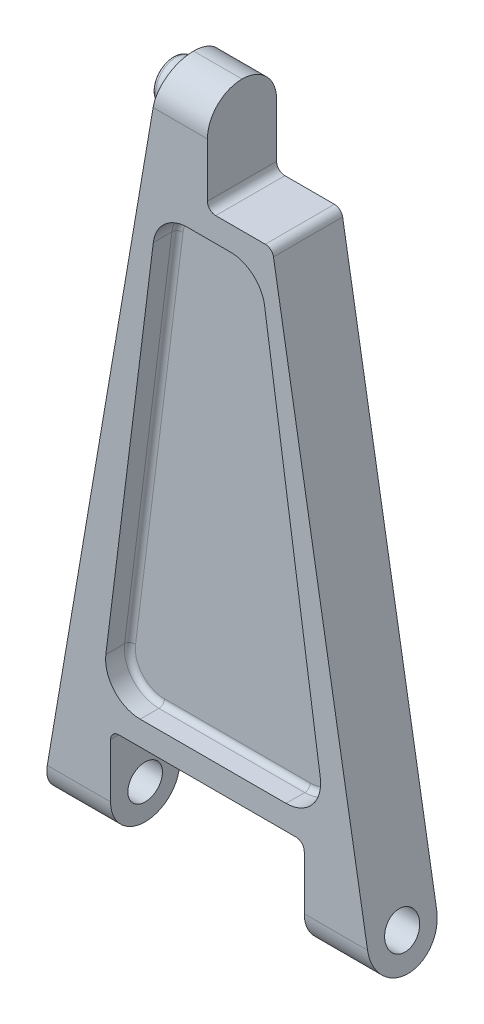
from build123d import *

# Parameters (mm, degrees)
BOSS_EXTRUDE1_DEPTH     = 50
FILLET1_R               = 50
CUT_EXTRUDE2_DEPTH      = 1030.611577246
CUT_EXTRUDE2_DEPTH_BACK = 1030.611577246
SKETCH4_W               = 280
SKETCH4_H               = 140
SKETCH4_W_2             = 94
SKETCH5_R               = 30
BOSS_EXTRUDE2_DEPTH     = 100
FILLET2_R               = 5
FILLET3_R               = 12
CUT_EXTRUDE4_DEPTH      = 35
FILLET4_R               = 50
FILLET5_R               = 8
FILLET4_OF_MIRROR1_R    = 50
FILLET5_OF_MIRROR1_R    = 8
SKETCH7_R               = 25
CUT_EXTRUDE5_DEPTH      = 250


with BuildPart() as part:
    # Sketch1 → Boss-Extrude1 (new, symmetric)
    with BuildSketch(Plane.XY):
        Polygon((-240, 0), (240, 0), (70, 1000), (-70, 1000), align=None)
    extrude(amount=BOSS_EXTRUDE1_DEPTH, both=True)

    # Fillet1
    fillet1_edges = [part.edges().sort_by_distance(p)[0] for p in [
        (0, 1000, 50),
        (0, 1000, -50),
        (0, 0, 50),
        (0, 0, -50),
    ]]
    fillet(fillet1_edges, radius=FILLET1_R - 0.0001)  # a hair under: the kernel refuses the full size

    # Sketch4 → Cut-Extrude2 (cut, two sides: drawn at the far end of the back side and taken through both)
    with BuildSketch(Plane.XY.offset(-CUT_EXTRUDE2_DEPTH_BACK)):
        with Locations((0, 70)):
            Rectangle(SKETCH4_W, SKETCH4_H)
        with Locations((47, 930)):
            Rectangle(SKETCH4_W_2, SKETCH4_H)
    extrude(amount=CUT_EXTRUDE2_DEPTH + CUT_EXTRUDE2_DEPTH_BACK, mode=Mode.SUBTRACT)

    # Sketch5 → Boss-Extrude2 (add)
    with BuildSketch(Plane(origin=(0, 0, 0), x_dir=(0, 0, -1), z_dir=(1, 0, 0))):
        with Locations((0, 950)):
            Circle(SKETCH5_R)
    extrude(amount=-BOSS_EXTRUDE2_DEPTH)

    # Fillet2
    fillet2_edges = [part.edges().sort_by_distance(p)[0] for p in [
        (-100, 950, 30),
    ]]
    fillet(fillet2_edges, radius=FILLET2_R)

    # Fillet3
    fillet3_edges = [part.edges().sort_by_distance(p)[0] for p in [
        (-140, 140, 0),
        (140, 140, 0),
        (93.8, 860, 0),
        (0, 860, 0),
    ]]
    fillet(fillet3_edges, radius=FILLET3_R)

    # Sketch6 → Cut-Extrude4 (cut)
    with BuildSketch(Plane.XY.offset(50)):
        Polygon((76.441272438, 825), (-72.757259745, 825), (-153.811728433, 175), (171.475101543, 175), align=None)
    cut_extrude4 = extrude(amount=-CUT_EXTRUDE4_DEPTH, mode=Mode.SUBTRACT)

    # Fillet4
    fillet4_edges = [part.edges().sort_by_distance(p)[0] for p in [
        (76.441272438, 825, 32.5),
        (171.475101543, 175, 32.5),
        (-153.811728433, 175, 32.5),
        (-72.757259745, 825, 32.5),
    ]]
    fillet(fillet4_edges, radius=FILLET4_R)

    # Fillet5
    fillet5_edges = [part.edges().sort_by_distance(p)[0] for p in [
        (122.900622431, 507.233392258, 15),
        (8.221853466, 175, 15),
        (2.307508674, 825, 15),
        (-112.512975158, 506.187040802, 15),
        (-61.700650501, 812.479007725, 15),
        (65.918080265, 812.826377126, 15),
        (-134.668529482, 191.904320827, 15),
        (151.459605814, 192.301908411, 15),
    ]]
    fillet(fillet5_edges, radius=FILLET5_R)

    # Mirror1: Cut-Extrude4 across plane
    add(cut_extrude4.mirror(Plane.XY), mode=Mode.SUBTRACT)

    # Fillet4 of Mirror1
    fillet4_of_mirror1_edges = [part.edges().sort_by_distance(p)[0] for p in [
        (76.441272438, 825, -32.5),
        (171.475101543, 175, -32.5),
        (-153.811728433, 175, -32.5),
        (-72.757259745, 825, -32.5),
    ]]
    fillet(fillet4_of_mirror1_edges, radius=FILLET4_OF_MIRROR1_R)

    # Fillet5 of Mirror1
    fillet5_of_mirror1_edges = [part.edges().sort_by_distance(p)[0] for p in [
        (122.900622431, 507.233392258, -15),
        (8.221853466, 175, -15),
        (2.307508674, 825, -15),
        (-112.512975158, 506.187040802, -15),
        (-61.700650501, 812.479007725, -15),
        (65.918080265, 812.826377126, -15),
        (-134.668529482, 191.904320827, -15),
        (151.459605814, 192.301908411, -15),
    ]]
    fillet(fillet5_of_mirror1_edges, radius=FILLET5_OF_MIRROR1_R)

    # Sketch7 → Cut-Extrude5 (cut, symmetric)
    with BuildSketch(Plane(origin=(0, 0, 0), x_dir=(0, 0, -1), z_dir=(1, 0, 0))):
        with Locations((0, 50)):
            Circle(SKETCH7_R)
    extrude(amount=CUT_EXTRUDE5_DEPTH, both=True, mode=Mode.SUBTRACT)


solid = part.part
